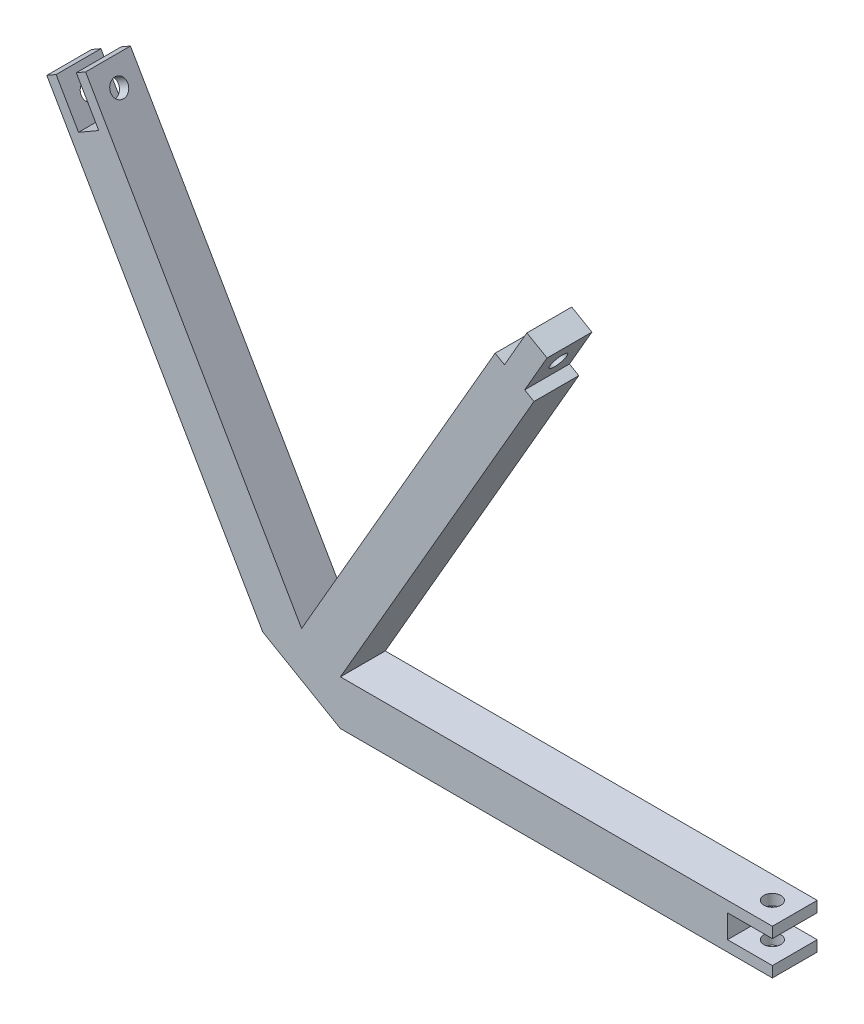
from build123d import *

# Parameters (mm, degrees)
SKETCH1_W               = 5
SKETCH1_H               = 5
SKETCH1_R               = 0.95
CENTER_DEPTH            = 1.3
RIGHTSIDE_START         = 1.3
SKETCH1_2_W             = 5
SKETCH1_2_H             = 5
SKETCH1_2_R             = 0.95
RIGHTSIDE_DEPTH         = 1.2
LEFTSIDE_START          = -1.3
SKETCH1_3_W             = 5
SKETCH1_3_H             = 5
SKETCH1_3_R             = 0.95
LEFTSIDE_DEPTH          = 1.2
SKETCH3_W               = 5
SKETCH3_H               = 5
BOSS_EXTRUDE4_DEPTH     = 47.5
CUT_EXTRUDE1_DEPTH      = 5
CIRPATTERN2_COUNT       = 6
CIRPATTERN3_COUNT       = 3
CIRPATTERN4_START       = -1.3
CIRPATTERN4_OUTLINE_W   = 5
CIRPATTERN4_OUTLINE_H   = 5
CIRPATTERN4_OUTLINE_R   = 0.95
CIRPATTERN4_DEPTH       = 2.6
CIRPATTERN4_START_2     = -44.601270189
CIRPATTERN4_2_OUTLINE_W = 5
CIRPATTERN4_2_OUTLINE_H = 5
CIRPATTERN4_2_OUTLINE_R = 0.95
CIRPATTERN4_2_DEPTH     = 2.6
CIRPATTERN4_3_OUTLINE_W = 5
CIRPATTERN4_3_OUTLINE_H = 5
CIRPATTERN4_3_OUTLINE_R = 0.95
CIRPATTERN4_3_DEPTH     = 2.6
SKETCH5_W               = 5
SKETCH5_H               = 2.6
CUT_EXTRUDE2_DEPTH      = 5


# Read off the part's stored shape, not the designer's step: CirPattern4
with BuildPart() as part:
    # Sketch1 → Center (new, symmetric)
    with BuildSketch(Plane(origin=(0, 0, 0), x_dir=(1, 0, 0), z_dir=(0, 1, 0))):
        Rectangle(SKETCH1_W, SKETCH1_H)
        with Locations(Location((0, 0, 0), (0, 0, 270))):
            Circle(SKETCH1_R, mode=Mode.SUBTRACT)
    extrude(amount=CENTER_DEPTH, both=True)

    # Sketch5 → Cut-Extrude2 (cut)
    with BuildSketch(Plane(origin=(2.5, 0, 0), x_dir=(0, 0, -1), z_dir=(1, 0, 0))):
        Rectangle(SKETCH5_W, SKETCH5_H)
    extrude(amount=-CUT_EXTRUDE2_DEPTH, mode=Mode.SUBTRACT)


with BuildPart() as body_2:
    # Sketch1<2> → RightSide (new body)
    with BuildSketch(Plane(origin=(0, 0, 0), x_dir=(1, 0, 0), z_dir=(0, 1, 0)).offset(RIGHTSIDE_START)):
        Rectangle(SKETCH1_2_W, SKETCH1_2_H)
        with Locations(Location((0, 0, 0), (0, 0, 270))):
            Circle(SKETCH1_2_R, mode=Mode.SUBTRACT)
    extrude(amount=RIGHTSIDE_DEPTH)


with BuildPart() as body_3:
    # Sketch1<3> → LeftSide (new body)
    with BuildSketch(Plane(origin=(0, 0, 0), x_dir=(1, 0, 0), z_dir=(0, 1, 0)).offset(LEFTSIDE_START)):
        Rectangle(SKETCH1_3_W, SKETCH1_3_H)
        with Locations(Location((0, 0, 0), (0, 0, 270))):
            Circle(SKETCH1_3_R, mode=Mode.SUBTRACT)
    extrude(amount=-LEFTSIDE_DEPTH)


with BuildPart() as body_4:
    # Sketch3 → Boss-Extrude4 (new body)
    with BuildSketch(Plane.ZY.offset(2.5)):
        Rectangle(SKETCH3_W, SKETCH3_H)
    extrude(amount=BOSS_EXTRUDE4_DEPTH)

    # Sketch4 → Cut-Extrude1 (cut)
    with BuildSketch(Plane.XY.offset(-2.5)):
        Polygon((-50, 0), (-50, -2.5), (-45.669872981, -2.5), align=None)
        Polygon((-50, 2.5), (-50, 0), (-45.669872981, 2.5), align=None)
    extrude(amount=CUT_EXTRUDE1_DEPTH, mode=Mode.SUBTRACT)


with BuildPart() as cirpattern2_1:
    # CirPattern2: pattern copy
    add(body_4.part.rotate(Axis((-50, 0, 0), (0, 0, 1)), 1 * 360 / CIRPATTERN2_COUNT))


with BuildPart() as cirpattern2_2:
    # CirPattern2: pattern copy
    add(body_4.part.rotate(Axis((-50, 0, 0), (0, 0, 1)), 2 * 360 / CIRPATTERN2_COUNT))


with BuildPart() as cirpattern2_3:
    # CirPattern2: pattern copy
    add(body_4.part.rotate(Axis((-50, 0, 0), (0, 0, 1)), 3 * 360 / CIRPATTERN2_COUNT))


with BuildPart() as cirpattern2_4:
    # CirPattern2: pattern copy
    add(body_4.part.rotate(Axis((-50, 0, 0), (0, 0, 1)), 4 * 360 / CIRPATTERN2_COUNT))


with BuildPart() as cirpattern2_5:
    # CirPattern2: pattern copy
    add(body_4.part.rotate(Axis((-50, 0, 0), (0, 0, 1)), 5 * 360 / CIRPATTERN2_COUNT))


with BuildPart() as cirpattern3_1:
    # CirPattern3: pattern copy
    add(body_3.part.rotate(Axis((-50, 0, 0), (0, 0, 1)), 1 * 360 / CIRPATTERN3_COUNT))


with BuildPart() as cirpattern3_2:
    # CirPattern3: pattern copy
    add(body_3.part.rotate(Axis((-50, 0, 0), (0, 0, 1)), 2 * 360 / CIRPATTERN3_COUNT))


with BuildPart() as cirpattern3_3:
    # CirPattern3: pattern copy
    add(body_2.part.rotate(Axis((-50, 0, 0), (0, 0, 1)), 1 * 360 / CIRPATTERN3_COUNT))


with BuildPart() as cirpattern3_4:
    # CirPattern3: pattern copy
    add(body_2.part.rotate(Axis((-50, 0, 0), (0, 0, 1)), 2 * 360 / CIRPATTERN3_COUNT))


with BuildPart() as body_14:
    # CirPattern4 outline → CirPattern4 (new body)
    with BuildSketch(Plane(origin=(0, 0, 0), x_dir=(1, 0, 0), z_dir=(0, 1, 0)).offset(CIRPATTERN4_START)):
        with Locations((-100, 0)):
            Rectangle(CIRPATTERN4_OUTLINE_W, CIRPATTERN4_OUTLINE_H)
        with Locations((-100, 0)):
            Circle(CIRPATTERN4_OUTLINE_R, mode=Mode.SUBTRACT)
    extrude(amount=CIRPATTERN4_DEPTH)


with BuildPart() as body_15:
    # CirPattern4 2 outline → CirPattern4 2 (new body)
    with BuildSketch(Plane(origin=(0, 0, 0), x_dir=(0.5000000000000098, -0.8660254037844329, 0), z_dir=(0.8660254037844329, 0.50000000000001, 0)).offset(CIRPATTERN4_START_2)):
        with Locations((25, 0)):
            Rectangle(CIRPATTERN4_2_OUTLINE_W, CIRPATTERN4_2_OUTLINE_H)
        with Locations((25, 0)):
            Circle(CIRPATTERN4_2_OUTLINE_R, mode=Mode.SUBTRACT)
    extrude(amount=CIRPATTERN4_2_DEPTH)


with BuildPart() as body_16:
    # CirPattern4 3 outline → CirPattern4 3 (new body)
    with BuildSketch(Plane(origin=(0, 0, 0), x_dir=(0.49999999999999767, 0.86602540378444, 0), z_dir=(0.8660254037844399, -0.49999999999999795, 0)).offset(CIRPATTERN4_START_2)):
        with Locations((25, 0)):
            Rectangle(CIRPATTERN4_3_OUTLINE_W, CIRPATTERN4_3_OUTLINE_H)
        with Locations((25, 0)):
            Circle(CIRPATTERN4_3_OUTLINE_R, mode=Mode.SUBTRACT)
    extrude(amount=CIRPATTERN4_3_DEPTH)


with BuildPart() as cirpattern3_1_1:
    add(cirpattern3_1.part)

    # Combine1: union CirPattern3_3, CirPattern2_2, body 16, CirPattern2_1, body 3, body 2, body 4
    add(cirpattern3_3.part)
    add(cirpattern2_2.part)
    add(body_16.part)
    add(cirpattern2_1.part)
    add(body_3.part)
    add(body_2.part)
    add(body_4.part)

    # Combine3: cut CirPattern2_5, CirPattern3_2, body 15, CirPattern2_4, CirPattern3_4, CirPattern2_3, body 14
    add(cirpattern2_5.part, mode=Mode.SUBTRACT)
    add(cirpattern3_2.part, mode=Mode.SUBTRACT)
    add(body_15.part, mode=Mode.SUBTRACT)
    add(cirpattern2_4.part, mode=Mode.SUBTRACT)
    add(cirpattern3_4.part, mode=Mode.SUBTRACT)
    add(cirpattern2_3.part, mode=Mode.SUBTRACT)
    add(body_14.part, mode=Mode.SUBTRACT)


solid = cirpattern3_1_1.part
